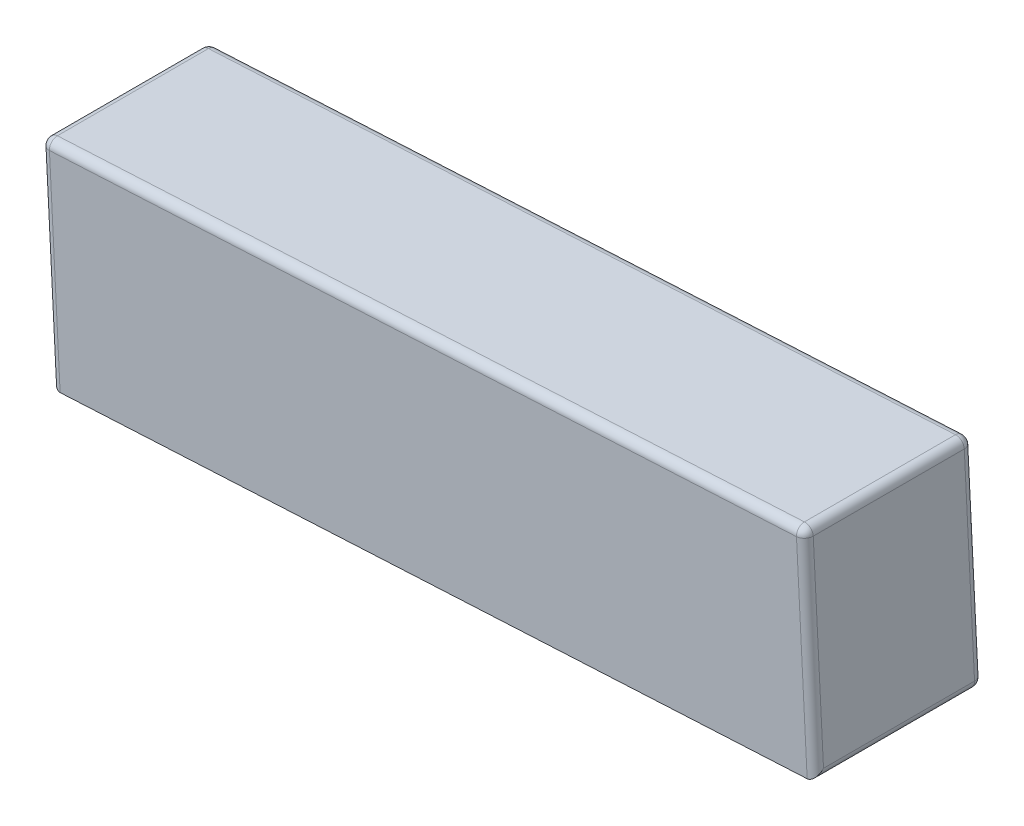
from build123d import *

# Parameters (mm, degrees)
BOSS_EXTRUDE1_DEPTH = 40
FILLET1_R           = 2
FILLET2_R           = 2


with BuildPart() as part:
    # Sketch1 → Boss-Extrude1 (new body)
    with BuildSketch(Plane.XY):
        Polygon((0, 0), (2.6534308254274332, -50.694494191060826), (184.70003032872677, -41.165884299703535), (182.04659950329932, 9.528609891357288), align=None)
    extrude(amount=BOSS_EXTRUDE1_DEPTH)

    # Fillet1
    fillet1_edges = [part.edges().sort_by_distance(p)[0] for p in [
        (183.37331491601304, -15.818637204173122, 40),
        (91.02329975164966, 4.764304945678644, 40),
        (183.37331491601304, -15.818637204173122, 0),
        (91.02329975164966, 4.764304945678644, 0),
        (182.04659950329932, 9.528609891357288, 20),
        (184.70003032872677, -41.165884299703535, 20),
    ]]
    fillet(fillet1_edges, radius=FILLET1_R)

    # Fillet2
    # the kernel refuses this fillet: 2 mm, written as the material it takes off along each edge
    with BuildSketch(Plane(origin=(182.59822426289585, -39.27315841843169, 2), x_dir=(0.052270046139774824, -0.9986329867756952, 0), z_dir=(0, 0, -1))) as fillet2_piece_1_section:
        Polygon((0, 0), (FILLET2_R, 0), (FILLET2_R, -FILLET2_R), (-6.3e-16, -FILLET2_R), align=None)
    fillet2_piece_1 = extrude(amount=FILLET2_R, mode=Mode.PRIVATE)
    fillet2_piece_1 = fillet2_piece_1 - Plane(origin=(182.59822426289585, -39.27315841843169, 2), x_dir=(-0.7431006609440385, 0.6691796527873013, 0), z_dir=(0, 0, -1)) * Sphere(FILLET2_R, mode=Mode.PRIVATE)
    add(fillet2_piece_1, mode=Mode.SUBTRACT)
    with BuildSketch(Plane(origin=(4.546156706699275, -48.5926881252299, 2), x_dir=(0, 0, -1), z_dir=(-0.9986329867756953, -0.052270046139774824, 0))) as fillet2_piece_2_section:
        Polygon((0, 0), (FILLET2_R, 0), (FILLET2_R, FILLET2_R), (0, FILLET2_R), align=None)
    fillet2_piece_2 = extrude(amount=FILLET2_R, mode=Mode.PRIVATE)
    fillet2_piece_2 = fillet2_piece_2 - Plane(origin=(4.546156706699275, -48.5926881252299, 2), x_dir=(-0.0369605040783685, 0.7061401568656699, 0.7071067811865475), z_dir=(-0.9986329867756953, -0.052270046139774824, 0)) * Sphere(FILLET2_R, mode=Mode.PRIVATE)
    add(fillet2_piece_2, mode=Mode.SUBTRACT)
    with BuildSketch(Plane(origin=(0.1045400922795495, -1.9972659735513878, 0), x_dir=(-5e-17, 0, 1), z_dir=(0.052270046139774824, -0.9986329867756953, 0))) as fillet2_piece_3:
        with BuildLine():
            CenterArc((FILLET2_R, -FILLET2_R), FILLET2_R, 90, 90.00000000000006)
            Line((-3.3e-16, -FILLET2_R), (0, 0))
            Line((0, 0), (FILLET2_R, 0))
        make_face()
    extrude(amount=46.76388909877601, mode=Mode.SUBTRACT)
    with BuildSketch(Plane(origin=(0.1045400922795495, -1.9972659735513878, 40), x_dir=(-5e-17, 0, -1), z_dir=(0.052270046139774824, -0.9986329867756953, 0))) as fillet2_piece_4:
        with BuildLine():
            CenterArc((FILLET2_R, FILLET2_R), FILLET2_R, 179.99999999999994, 90.00000000000006)
            Line((-1.1e-16, FILLET2_R), (0, 0))
            Line((0, 0), (FILLET2_R, 0))
        make_face()
    extrude(amount=53.763889098776026, mode=Mode.SUBTRACT)
    with BuildSketch(Plane(origin=(0, 0, 1.9999999999999996), x_dir=(0.052270046139775025, -0.9986329867756953, 0), z_dir=(0, 0, 1))) as fillet2_piece_5:
        with BuildLine():
            CenterArc((FILLET2_R, FILLET2_R), FILLET2_R, 180.00000000000034, 89.99999999999966)
            Line((9e-16, FILLET2_R), (0, 0))
            Line((0, 0), (FILLET2_R, 0))
        make_face()
    extrude(amount=36, mode=Mode.SUBTRACT)
    with BuildSketch(Plane(origin=(0.1045400922795352, -1.9972659735513885, 38), x_dir=(-0.05227004613977481, 0.9986329867756952, 0), z_dir=(0, 0, -1))) as fillet2_piece_6:
        with BuildLine():
            CenterArc((2 - FILLET2_R, FILLET2_R), FILLET2_R, 270, 89.99999999999885)
            Line((1.9999999999999998, FILLET2_R), (2, 0))
            Line((2, 0), (2 - FILLET2_R, 1.42e-14))
        make_face()
    revolve(axis=Axis((0.1045400922795352, -1.9972659735513885, 38), (0.9986329867756952, 0.05227004613977481, 0)), revolution_arc=90, mode=Mode.SUBTRACT)
    with BuildSketch(Plane(origin=(0.1045400922795352, -1.9972659735513885, 1.9999999999999996), x_dir=(-0.05227004613977481, 0.9986329867756952, 0), z_dir=(1e-17, -1.1e-16, 1))) as fillet2_piece_7:
        with BuildLine():
            CenterArc((2 - FILLET2_R, -FILLET2_R), FILLET2_R, 1.15136e-12, 89.99999999999886)
            Line((1.9999999999999998, -FILLET2_R), (2, 0))
            Line((2, 0), (2 - FILLET2_R, -1.42e-14))
        make_face()
    revolve(axis=Axis((0.1045400922795352, -1.9972659735513885, 1.9999999999999996), (-0.9986329867756952, -0.05227004613977481, 0)), revolution_arc=90, mode=Mode.SUBTRACT)
    with BuildSketch(Plane(origin=(4.650696798978822, -50.58995409878128, 0), x_dir=(-0.05227004613977483, 0.9986329867756953, 0), z_dir=(0.9986329867756952, 0.052270046139774824, 0))) as fillet2_piece_8:
        with BuildLine():
            CenterArc((FILLET2_R, FILLET2_R), FILLET2_R, 180, 90)
            Line((-5e-17, FILLET2_R), (0, 0))
            Line((0, 0), (FILLET2_R, 0))
        make_face()
    extrude(amount=178.29580027300779, mode=Mode.SUBTRACT)
    with BuildSketch(Plane(origin=(2.6534308254274332, -50.694494191060826, 2), x_dir=(-0.05227004613977479, 0.9986329867756952, 0), z_dir=(0, 0, 1))) as fillet2_piece_9:
        with BuildLine():
            CenterArc((FILLET2_R, -FILLET2_R), FILLET2_R, 90, 90)
            Line((-1.444e-14, -FILLET2_R), (0, 0))
            Line((0, 0), (FILLET2_R, 0))
        make_face()
    extrude(amount=43, mode=Mode.SUBTRACT)


solid = part.part
